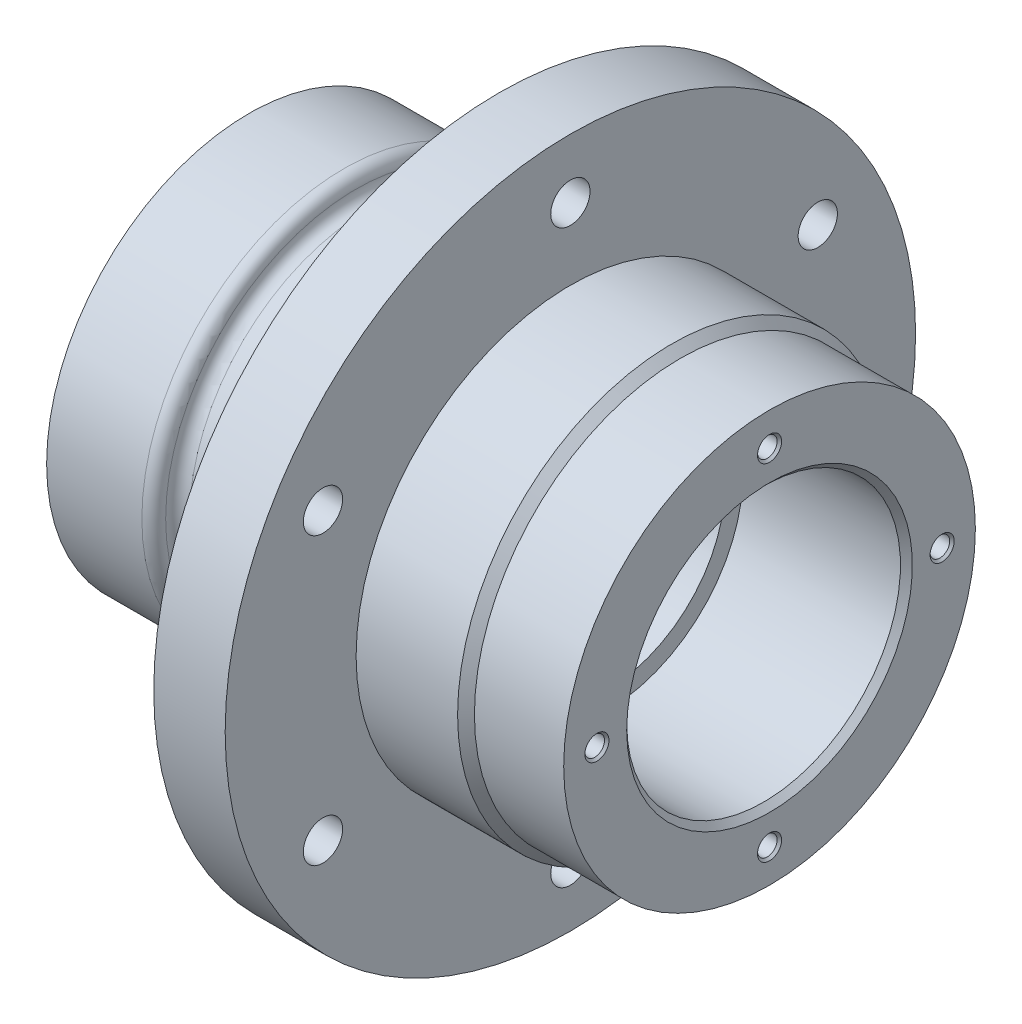
from build123d import *

# Parameters (mm, degrees)
SKETCH2_R                       = 7
BOSS_EXTRUDE1_DEPTH             = 2
FILLET1_R                       = 2.000000064
SKETCH3_R                       = 3.3
CUT_EXTRUDE1_DEPTH              = 95.766055219
M4X0_7_TAPPED_HOLE1_D           = 3.3
M4X0_7_TAPPED_HOLE1_DEPTH       = 13.3999986
M4X0_7_TAPPED_HOLE1_CSINK_D     = 4.05
M4X0_7_TAPPED_HOLE1_CSINK_ANGLE = 90
M4X0_7_TAPPED_HOLE1_TIP         = 0.991420021
M4X0_7_TAPPED_HOLE2_D           = 3.3
M4X0_7_TAPPED_HOLE2_DEPTH       = 13.462
M4X0_7_TAPPED_HOLE2_CSINK_D     = 4.05
M4X0_7_TAPPED_HOLE2_CSINK_ANGLE = 90
M4X0_7_TAPPED_HOLE2_TIP         = 0.991420021
FILLET2_R                       = 2.000000064


with BuildPart() as part:
    # Sketch1 → Revolve1 (revolve)
    with BuildSketch(Plane.XY, mode=Mode.PRIVATE) as revolve1_sk:
        with BuildLine():
            Line((0, 34), (0, 23))
            Line((0, 23), (15.575182577, 23))
            ThreePointArc((15.575182577, 23), (16.989396139, 22.414213562), (17.575182577, 21))
            Line((17.575182577, 21), (17.575182577, 20))
            Line((17.575182577, 20), (28, 20))
            Line((28, 20), (28, 16))
            Line((28, 16), (48, 16))
            Line((48, 16), (48, 18))
            ThreePointArc((48, 18), (48.585786438, 19.414213562), (50, 20))
            Line((50, 20), (60, 20))
            Line((60, 20), (60, 23))
            Line((60, 23), (86.461618407, 23))
            Line((86.461618407, 23), (87.461618407, 24))
            Line((87.461618407, 24), (87.461618407, 34.585786392))
            Line((87.461618407, 34.585786392), (72.461618407, 34.585786392))
            Line((72.461618407, 34.585786392), (71.047404799, 36))
            Line((71.047404799, 36), (54, 36))
            Line((54, 36), (54, 58))
            Line((54, 58), (42, 58))
            Line((42, 58), (42, 32))
            ThreePointArc((42, 32), (41.414213562, 30.585786438), (40, 30))
            Line((40, 30), (18, 30))
            Line((18, 30), (18, 34))
            Line((18, 34), (0, 34))
        make_face()
    revolve(revolve1_sk.sketch.rotate(Axis((0, 0, 0), (1, 0, 0)), 90), axis=Axis((0, 0, 0), (1, 0, 0)))

    # Sketch2 → Boss-Extrude1 (add)
    with BuildSketch(Plane.ZY.offset(-42)):
        with Locations(Location((0, 48, 0), (0, 0, 180))):
            Circle(SKETCH2_R)
        with Locations(Location((41.569219382, 24, 0), (0, 0, 180))):
            Circle(SKETCH2_R)
        with Locations(Location((41.569219382, -24, 0), (0, 0, 180))):
            Circle(SKETCH2_R)
        with Locations(Location((0, -48, 0), (0, 0, 180))):
            Circle(SKETCH2_R)
        with Locations(Location((-41.569219382, -24, 0), (0, 0, 180))):
            Circle(SKETCH2_R)
        with Locations(Location((-41.569219382, 24, 0), (0, 0, 180))):
            Circle(SKETCH2_R)
    extrude(amount=BOSS_EXTRUDE1_DEPTH)

    # Fillet1
    fillet1_edges = [part.edges().sort_by_distance(p)[0] for p in [
        (42, 48, 7),
        (42, 24, 48.569219382),
        (42, -24, 48.569219382),
        (42, -48, 7),
        (42, -24, -34.569219382),
        (42, 24, -34.569219382),
    ]]
    fillet(fillet1_edges, radius=FILLET1_R - 0.0001)  # a hair under: the kernel refuses the full size

    # Sketch3 → Cut-Extrude1 (cut, through all)
    with BuildSketch(Plane.ZY.offset(-40)):
        with Locations((0, 48)):
            Circle(SKETCH3_R)
        with Locations((41.569219382, 24)):
            Circle(SKETCH3_R)
        with Locations((41.569219382, -24)):
            Circle(SKETCH3_R)
        with Locations((0, -48)):
            Circle(SKETCH3_R)
        with Locations((-41.569219382, -24)):
            Circle(SKETCH3_R)
        with Locations((-41.569219382, 24)):
            Circle(SKETCH3_R)
    extrude(amount=-CUT_EXTRUDE1_DEPTH, mode=Mode.SUBTRACT)

    # M4x0.7 Tapped Hole1
    with Locations(Plane(origin=(87.461618407, 29, 0), x_dir=(0, 0, 1), z_dir=(1, 0, 0))):
        with Locations((0, 0), (-29, 29), (0, 58), (29, 29)):
            CounterSinkHole(M4X0_7_TAPPED_HOLE1_D / 2, M4X0_7_TAPPED_HOLE1_CSINK_D / 2, depth=M4X0_7_TAPPED_HOLE1_DEPTH, counter_sink_angle=M4X0_7_TAPPED_HOLE1_CSINK_ANGLE)
            with Locations((0, 0, -(M4X0_7_TAPPED_HOLE1_DEPTH + M4X0_7_TAPPED_HOLE1_TIP / 2))):  # 118° drill point
                Cone(0, M4X0_7_TAPPED_HOLE1_D / 2, M4X0_7_TAPPED_HOLE1_TIP, mode=Mode.SUBTRACT)

    # M4x0.7 Tapped Hole2
    with Locations(Plane(origin=(0, 28.956, 0), x_dir=(0, 0, -1), z_dir=(-1, 0, 0))):
        with Locations((0, 0), (-28.956, 28.956), (28.956, 28.956), (0, 57.912)):
            CounterSinkHole(M4X0_7_TAPPED_HOLE2_D / 2, M4X0_7_TAPPED_HOLE2_CSINK_D / 2, depth=M4X0_7_TAPPED_HOLE2_DEPTH, counter_sink_angle=M4X0_7_TAPPED_HOLE2_CSINK_ANGLE)
            with Locations((0, 0, -(M4X0_7_TAPPED_HOLE2_DEPTH + M4X0_7_TAPPED_HOLE2_TIP / 2))):  # 118° drill point
                Cone(0, M4X0_7_TAPPED_HOLE2_D / 2, M4X0_7_TAPPED_HOLE2_TIP, mode=Mode.SUBTRACT)

    # Fillet2
    fillet2_edges = [part.edges().sort_by_distance(p)[0] for p in [
        (18, 0, -34),
        (18, 0, -30),
    ]]
    fillet(fillet2_edges, radius=FILLET2_R - 0.0001)  # a hair under: the kernel refuses the full size


solid = part.part
